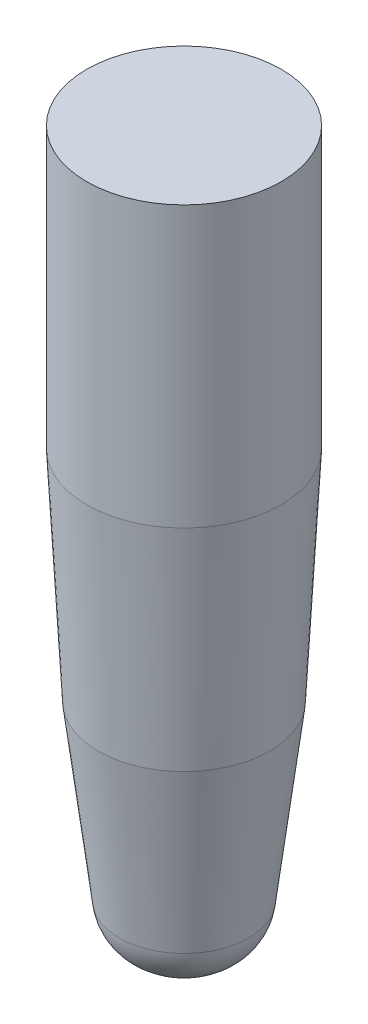
from build123d import *
from build123d.topology import SkipClean

# Parameters (mm, degrees)
SKETCH_608_R        = 8
EXTRUDE_1_DEPTH     = 22
EXTRUDE_2_OUTLINE_W = 8
EXTRUDE_2_OUTLINE_H = 1


# Read off the part's stored shape, not the designer's step: 凸台-拉伸2
with BuildPart() as part:
    # Sketch 608 → 凸台-拉伸1 (new body)
    with BuildSketch(Plane(origin=(0, 0, 0), x_dir=(1, 0, 0), z_dir=(0, 1, 0))):
        with Locations(Location((0, 0, 0), (0, 0, 270))):
            Circle(SKETCH_608_R)
    extrude(amount=EXTRUDE_1_DEPTH)

    # 凸台-拉伸2 outline → 凸台-拉伸2 (revolve)
    with SkipClean():  # the faces are left unmerged after this step: merging them gives an invalid solid
        with BuildSketch(Plane.XY):
            with Locations((4, 22.5)):
                Rectangle(EXTRUDE_2_OUTLINE_W, EXTRUDE_2_OUTLINE_H)
            Polygon((8, 0), (0, 0), (0, -18), (7.056659973, -18), align=None)
        revolve(axis=Axis((0, 0, 0), (0, 1, 0)))
    add(part.part.scale(1), mode=Mode.REPLACE)  # the faces are merged on a copy

    # 草图7 → 旋转4 (revolve)
    with BuildSketch(Plane.XY, mode=Mode.PRIVATE) as revolve_4_sk:
        with BuildLine():
            Line((0, -18), (7.056659973, -18))
            Line((7.056659973, -18), (5.315312922, -32.182133633))
            ThreePointArc((5.315312922, -32.182133633), (3.880886548, -34.908529724), (1, -36))
            Line((1, -36), (0, -36))
            Line((0, -36), (0, -18))
        make_face()
    revolve(revolve_4_sk.sketch.rotate(Axis((0, -18, 0), (0, -1, 0)), 90), axis=Axis((0, -18, 0), (0, -1, 0)))


solid = part.part
